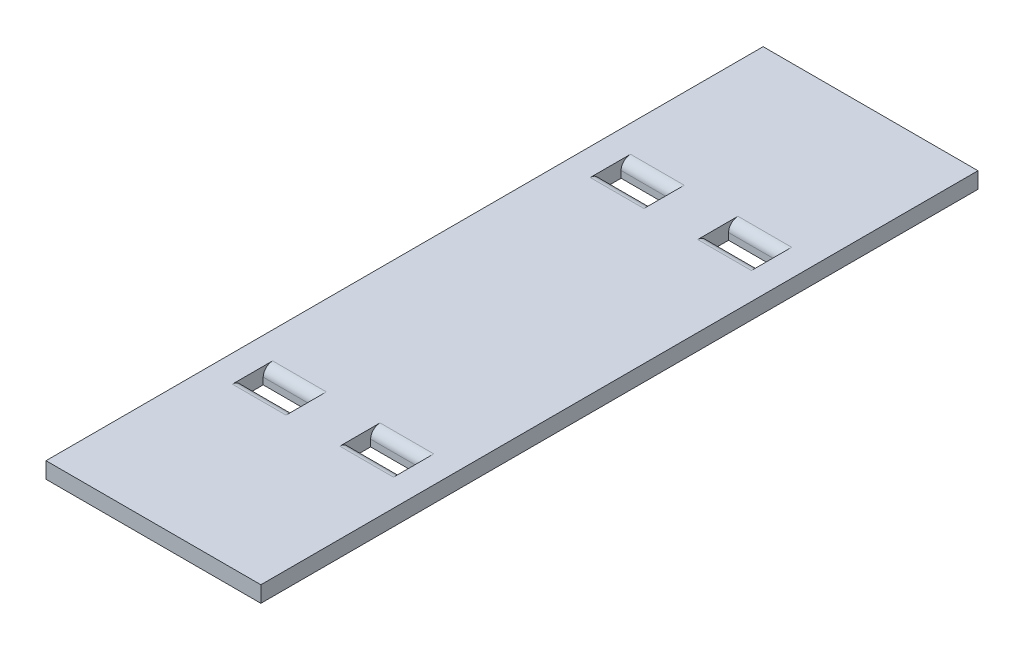
from build123d import *

# Parameters (mm, degrees)
SKETCH1_W           = 40
SKETCH1_H           = 133.5
BOSS_EXTRUDE1_DEPTH = 3
SKETCH2_R           = 6.11
BOSS_EXTRUDE2_DEPTH = 3
CUT_EXTRUDE1_REACH  = 71.94
SKETCH3_W           = 10
SKETCH3_H           = 4
FILLET2_R           = 1.75
FILLET3_R           = 1


with BuildPart() as part:
    # Sketch1 → Boss-Extrude1 (new body)
    with BuildSketch(Plane(origin=(0, 0, 0), x_dir=(1, 0, 0), z_dir=(0, 1, 0))):
        Rectangle(SKETCH1_W, SKETCH1_H)
    extrude(amount=BOSS_EXTRUDE1_DEPTH)

    # Sketch2 → Boss-Extrude2 (add)
    with BuildSketch(Plane.XZ):
        with Locations((10, 56.75)):
            Circle(SKETCH2_R)
        with Locations((-10, 56.75)):
            Circle(SKETCH2_R)
        with Locations((-10, -56.75)):
            Circle(SKETCH2_R)
        with Locations((10, -56.75)):
            Circle(SKETCH2_R)
    extrude(amount=BOSS_EXTRUDE2_DEPTH)

    # Sketch3 → Cut-Extrude1 (cut, up to next)
    with BuildSketch(Plane(origin=(0, 3, 0), x_dir=(1, 0, 0), z_dir=(0, 1, 0)), mode=Mode.PRIVATE) as cut_extrude1_sk1:
        with Locations((10, 33.3125)):
            Rectangle(SKETCH3_W, SKETCH3_H)
    cut_extrude1_tool1 = extrude(cut_extrude1_sk1.sketch, amount=-CUT_EXTRUDE1_REACH, mode=Mode.PRIVATE) & part.part
    # Sketch3 → Cut-Extrude1 (cut, up to next)
    with BuildSketch(Plane(origin=(0, 3, 0), x_dir=(1, 0, 0), z_dir=(0, 1, 0)), mode=Mode.PRIVATE) as cut_extrude1_sk2:
        with Locations((-10, 33.3125)):
            Rectangle(SKETCH3_W, SKETCH3_H)
    cut_extrude1_tool2 = extrude(cut_extrude1_sk2.sketch, amount=-CUT_EXTRUDE1_REACH, mode=Mode.PRIVATE) & part.part
    # Sketch3 → Cut-Extrude1 (cut, up to next)
    with BuildSketch(Plane(origin=(0, 3, 0), x_dir=(1, 0, 0), z_dir=(0, 1, 0)), mode=Mode.PRIVATE) as cut_extrude1_sk3:
        with Locations((-10, -33.3125)):
            Rectangle(SKETCH3_W, SKETCH3_H)
    cut_extrude1_tool3 = extrude(cut_extrude1_sk3.sketch, amount=-CUT_EXTRUDE1_REACH, mode=Mode.PRIVATE) & part.part
    # Sketch3 → Cut-Extrude1 (cut, up to next)
    with BuildSketch(Plane(origin=(0, 3, 0), x_dir=(1, 0, 0), z_dir=(0, 1, 0)), mode=Mode.PRIVATE) as cut_extrude1_sk4:
        with Locations((10, -33.3125)):
            Rectangle(SKETCH3_W, SKETCH3_H)
    cut_extrude1_tool4 = extrude(cut_extrude1_sk4.sketch, amount=-CUT_EXTRUDE1_REACH, mode=Mode.PRIVATE) & part.part
    add(cut_extrude1_tool1.solids().sort_by_distance((10, 3, -33.3125))[0], mode=Mode.SUBTRACT)
    add(cut_extrude1_tool2.solids().sort_by_distance((-10, 3, -33.3125))[0], mode=Mode.SUBTRACT)
    add(cut_extrude1_tool3.solids().sort_by_distance((-10, 3, 33.3125))[0], mode=Mode.SUBTRACT)
    add(cut_extrude1_tool4.solids().sort_by_distance((10, 3, 33.3125))[0], mode=Mode.SUBTRACT)

    # Fillet2
    fillet2_edges = [part.edges().sort_by_distance(p)[0] for p in [
        (10, 3, -35.3125),
        (10, 3, -31.3125),
        (-10, 3, -35.3125),
        (-10, 3, -31.3125),
        (-10, 3, 35.3125),
        (-10, 3, 31.3125),
        (10, 3, 35.3125),
        (10, 3, 31.3125),
    ]]
    fillet(fillet2_edges, radius=FILLET2_R)

    # Fillet3
    fillet3_edges = [part.edges().sort_by_distance(p)[0] for p in [
        (-16.11, -3, 56.75),
        (3.89, -3, 56.75),
        (-16.11, -3, -56.75),
        (3.89, -3, -56.75),
    ]]
    fillet(fillet3_edges, radius=FILLET3_R)


solid = part.part
